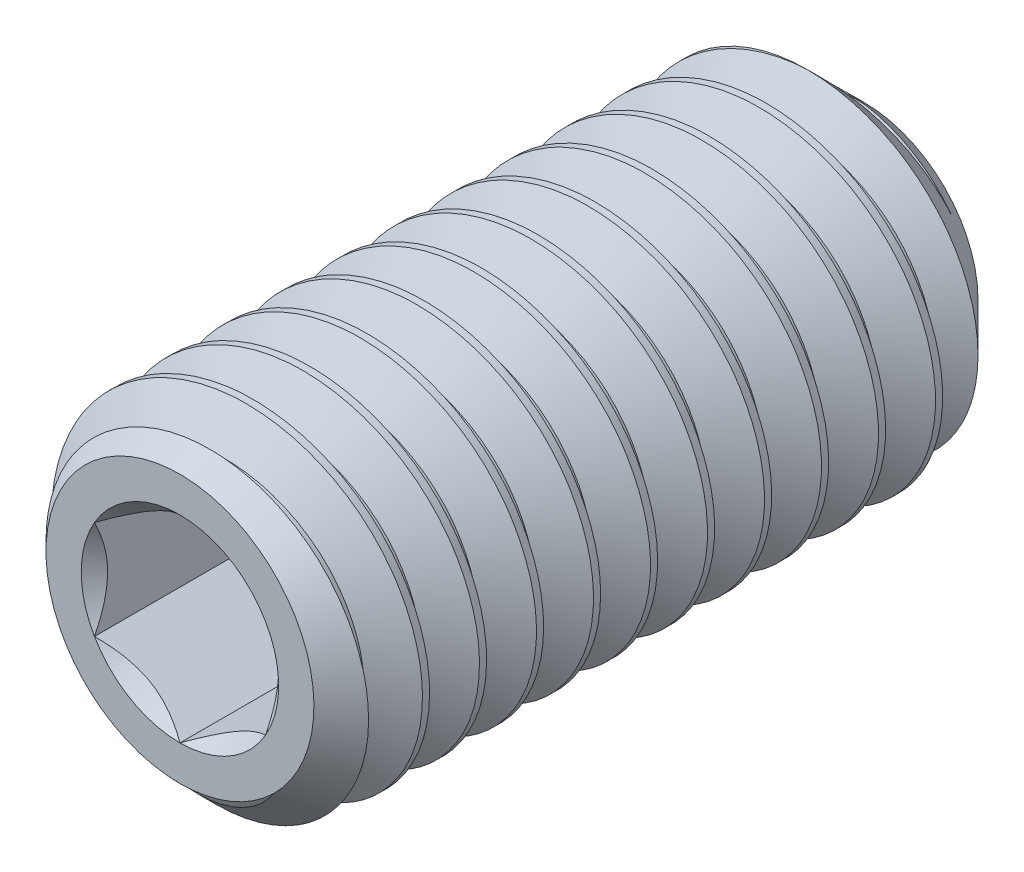
from build123d import *

# Parameters (mm, degrees)
CUT_EXTRUDE1_DEPTH     = 3
CUT_SWEEP1_PITCH       = 0.5000000000000001
CUT_SWEEP1_HEIGHT      = 6.500000000000012
CUT_SWEEP1_RADIUS      = 1.5000000000000002
CUT_SWEEP1_START_ANGLE = 89.99999999999974


with BuildPart() as part:
    # Sketch2 → Revolve1 (revolve)
    with BuildSketch(Plane(origin=(0, 0, 0), x_dir=(0, 0, -1), z_dir=(1, 0, 0)), mode=Mode.PRIVATE) as revolve1_sk:
        Polygon((-3, 0), (3, 0), (3, 1), (2.500000000000002, 1.5), (-2.6752404735808373, 1.5), (-3, 1.1752404735808362), align=None)
    revolve(revolve1_sk.sketch.rotate(Axis((0, 0, 3), (0, 0, -1)), 90), axis=Axis((0, 0, 3), (0, 0, -1)))

    # Sketch3 → Cut-Extrude1 (cut)
    with BuildSketch(Plane.XY.offset(3)):
        Polygon((0, 0.8660254037844385), (-0.7499999999999998, 0.43301270189221924), (-0.7499999999999999, -0.43301270189221897), (-1.3e-16, -0.866025403784438), (0.7499999999999992, -0.4330127018922194), (0.7499999999999993, 0.4330127018922194), align=None)
    extrude(amount=-CUT_EXTRUDE1_DEPTH, mode=Mode.SUBTRACT)

    # Cut-Extrude2 cone 1 section (through the dimple's axis) → Cut-Extrude2 (revolve, cut)
    with BuildSketch(Plane(origin=(0, 0, 0), x_dir=(0, -1, 0), z_dir=(1, 0, 0))):
        Polygon((0, 0), (0.75, 0), (0, 0.433012702), align=None)
    revolve(axis=Axis((0, 0, 0), (0, 0, -1)), mode=Mode.SUBTRACT)

    # Cut-Extrude3 cone 1 section (through the dimple's axis) → Cut-Extrude3 (revolve, cut)
    with BuildSketch(Plane(origin=(0, 0, 3), x_dir=(0, -1, 0), z_dir=(1, 0, 0))):
        Polygon((0, 0), (0.866025404, 0), (0, 0.866025404), align=None)
    revolve(axis=Axis((0, 0, 3), (0, 0, -1)), mode=Mode.SUBTRACT)

    # Cut-Sweep1: sweep along a helix
    with BuildLine() as cut_sweep1_path:
        add(Helix(CUT_SWEEP1_PITCH, CUT_SWEEP1_HEIGHT, CUT_SWEEP1_RADIUS, center=(0, 0, 3), direction=(0, 0, -1), mode=Mode.PRIVATE).rotate(Axis((0, 0, 3), (0, 0, -1)), CUT_SWEEP1_START_ANGLE))
    # Sketch7 → Cut-Sweep1 (sweep, cut)
    with BuildSketch(Plane(origin=(0, 0, 0), x_dir=(0, 0, -1), z_dir=(1, 0, 0))):
        Polygon((-3.453125000000001, 1.5270632938682638), (-2.9843750000000013, 1.5270632938682638), (-3.1875000000000004, 1.1752404735808362), (-3.250000000000001, 1.1752404735808362), align=None)
    sweep(path=cut_sweep1_path.line, is_frenet=True, mode=Mode.SUBTRACT)


solid = part.part
